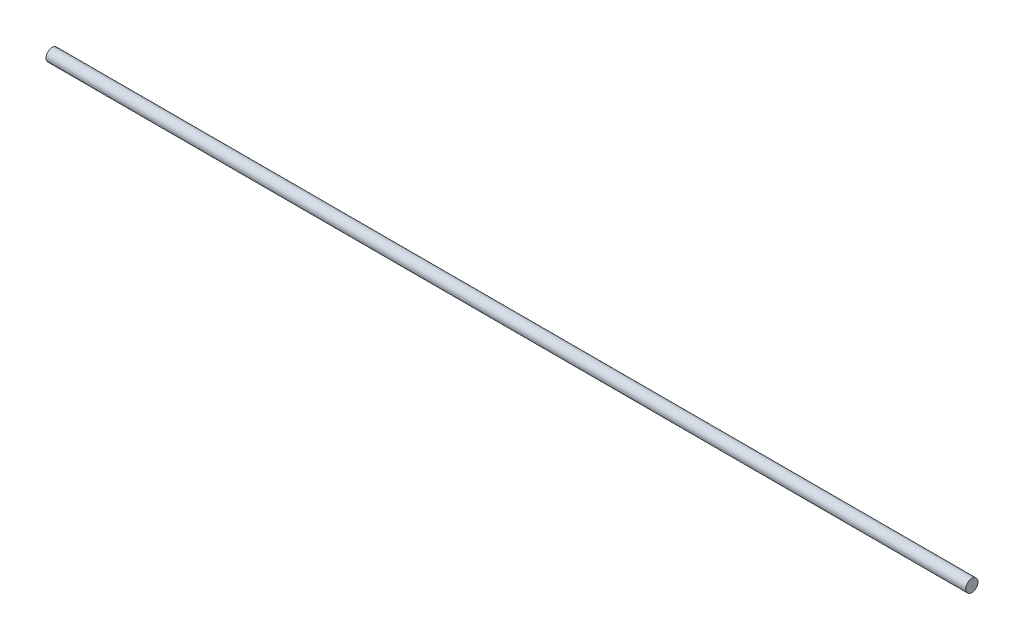
from build123d import *

# Parameters (mm, degrees)
SKETCH1_R           = 4
BOSS_EXTRUDE1_DEPTH = 600


with BuildPart() as part:
    # Sketch1 → Boss-Extrude1 (new body)
    with BuildSketch(Plane(origin=(0, 0, 0), x_dir=(0, 0, -1), z_dir=(1, 0, 0))):
        Circle(SKETCH1_R)
    extrude(amount=BOSS_EXTRUDE1_DEPTH)


solid = part.part
